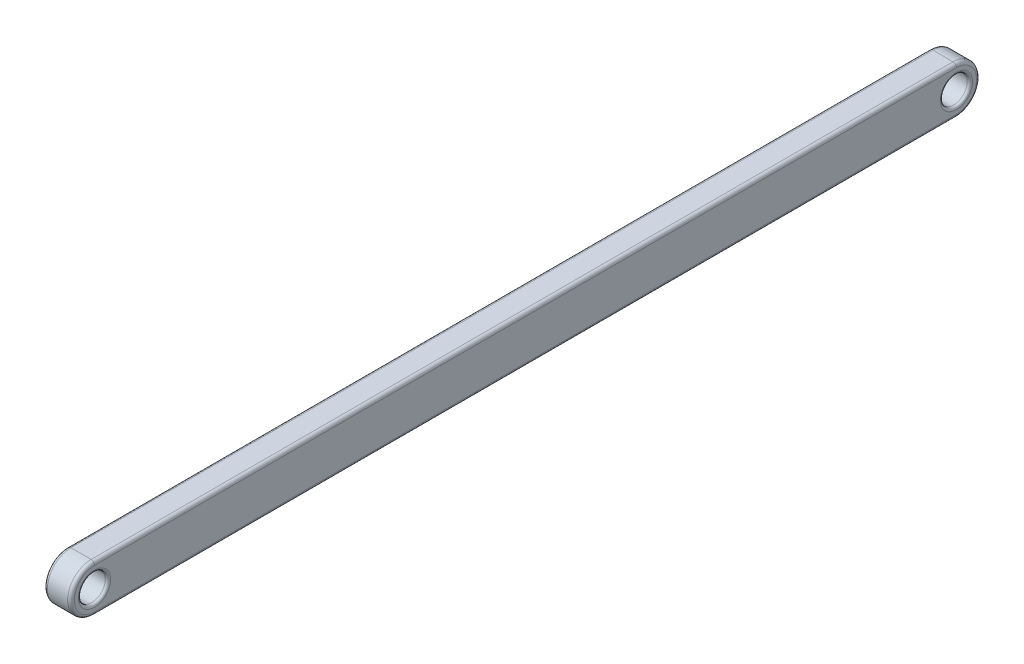
from build123d import *

# Parameters (mm, degrees)
SKETCH1_R           = 0.5
BOSS_EXTRUDE1_DEPTH = 1
FILLET1_R           = 0.125
FILLET2_R           = 0.1


with BuildPart() as part:
    # Sketch1 → Boss-Extrude1 (new body)
    with BuildSketch(Plane(origin=(0, 0, 0), x_dir=(0, 0, -1), z_dir=(1, 0, 0))):
        with BuildLine():
            Line((30, 0), (0, 0))
            Line((0, 0), (-1, 0))
            ThreePointArc((-1, 0), (-1.875, -0.875), (-1, -1.75))
            Line((-1, -1.75), (0, -1.75))
            Line((0, -1.75), (30, -1.75))
            Line((30, -1.75), (31, -1.75))
            ThreePointArc((31, -1.75), (31.875, -0.875), (31, 0))
            Line((31, 0), (30, 0))
        make_face()
        with Locations((-1, -0.875)):
            Circle(SKETCH1_R, mode=Mode.SUBTRACT)
        with Locations((31, -0.875)):
            Circle(SKETCH1_R, mode=Mode.SUBTRACT)
    extrude(amount=BOSS_EXTRUDE1_DEPTH)

    # Fillet1
    fillet1_edges = [part.edges().sort_by_distance(p)[0] for p in [
        (1, -0.875, -31.875),
        (1, 0, -15),
        (1, -0.875, 1.875),
        (0, -0.875, -31.875),
        (0, 0, -15),
        (0, -0.875, 1.875),
        (1, -1.75, -15),
        (0, -1.75, -15),
    ]]
    fillet(fillet1_edges, radius=FILLET1_R)

    # Fillet2
    fillet2_edges = [part.edges().sort_by_distance(p)[0] for p in [
        (0, -0.875, -30.5),
        (1, -0.875, -30.5),
        (0, -0.875, 1.5),
        (1, -0.875, 1.5),
    ]]
    fillet(fillet2_edges, radius=FILLET2_R)


solid = part.part
